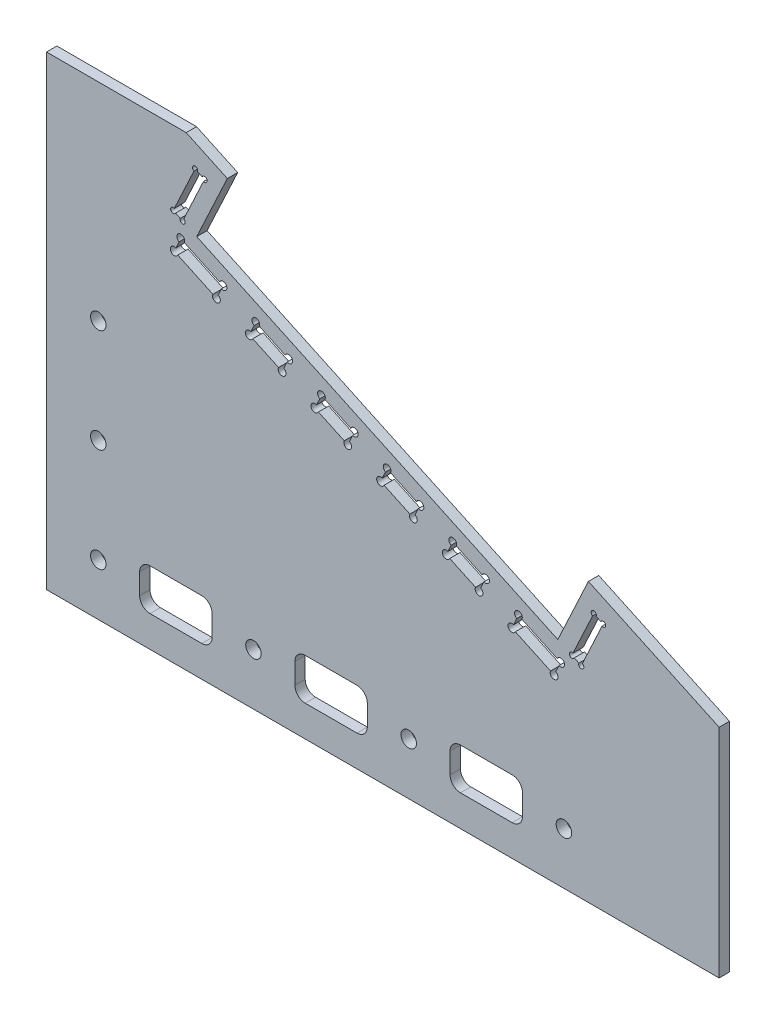
from build123d import *

# Parameters (mm, degrees)
SKETCH_1_W          = 130
SKETCH_1_H          = 90
SKETCH_1_R          = 1.5
EXTRUDE_1_DEPTH     = 2
CUT_EXTRUDE_1_DEPTH = 159.126531613
CUT_EXTRUDE_2_DEPTH = 159.126531613
CUT_EXTRUDE_3_DEPTH = 159.126531613
SKETCH_6_R          = 0.75
SKETCH_6_R_2        = 0.5
CUT_EXTRUDE_5_DEPTH = 10
CUT_EXTRUDE_7_DEPTH = 159.126531613


with BuildPart() as part:
    # 草图1 → 凸台-拉伸1 (new body)
    with BuildSketch(Plane.XY):
        with Locations((65, 45)):
            Rectangle(SKETCH_1_W, SKETCH_1_H)
        with Locations((10, 10)):
            Circle(SKETCH_1_R, mode=Mode.SUBTRACT)
        with Locations((10, 30)):
            Circle(SKETCH_1_R, mode=Mode.SUBTRACT)
        with Locations((10, 50)):
            Circle(SKETCH_1_R, mode=Mode.SUBTRACT)
        with Locations((40, 10)):
            Circle(SKETCH_1_R, mode=Mode.SUBTRACT)
        with Locations((70, 10)):
            Circle(SKETCH_1_R, mode=Mode.SUBTRACT)
        with Locations((100, 10)):
            Circle(SKETCH_1_R, mode=Mode.SUBTRACT)
    extrude(amount=EXTRUDE_1_DEPTH)

    # 草图2 → 切除-拉伸1 (cut, through all)
    with BuildSketch(Plane.XY.offset(2)):
        Polygon((27, 90), (130, 41.97031121), (130, 90), align=None)
    extrude(amount=-CUT_EXTRUDE_1_DEPTH, mode=Mode.SUBTRACT)

    # 草图3 → 切除-拉伸2 (cut, through all)
    with BuildSketch(Plane.XY.offset(2)):
        Polygon((34.948319292, 86.293637845), (104.734018894, 53.752031691), (98.81736323, 41.063722672), (29.031663628, 73.605328826), align=None)
    extrude(amount=-CUT_EXTRUDE_2_DEPTH, mode=Mode.SUBTRACT)

    # 草图4 → 切除-拉伸3 (cut, through all)
    with BuildSketch(Plane.XY.offset(2)):
        Polygon((30.538922884, 83.936261482), (26.312740267, 74.873183611), (24.491061615, 75.722646317), (28.717244232, 84.785724188), align=None)
        Polygon((105.762469208, 48.858945757), (101.536286591, 39.795867887), (103.348902165, 38.950631363), (107.575084782, 48.013709234), align=None)
        Polygon((25.951193269, 71.731641988), (34.107963352, 67.928077633), (32.840108567, 65.209154272), (24.683338483, 69.012718627), align=None)
        Polygon((40.452117861, 64.969749801), (46.79627237, 62.011421968), (45.528417585, 59.292498607), (39.184263076, 62.250826439), align=None)
        Polygon((78.517044917, 47.219782807), (84.861199426, 44.261454975), (83.593344641, 41.542531614), (77.249190132, 44.500859446), align=None)
        Polygon((91.205353935, 41.303127143), (99.362124019, 37.499562787), (98.094269233, 34.780639426), (89.93749915, 38.584203782), align=None)
        Polygon((53.14042688, 59.053094136), (59.484581389, 56.094766304), (58.216726604, 53.375842943), (51.872572095, 56.334170775), align=None)
        Polygon((65.828735898, 53.136438472), (72.172890408, 50.17811064), (70.905035622, 47.459187279), (64.560881113, 50.417515111), align=None)
    extrude(amount=-CUT_EXTRUDE_3_DEPTH, mode=Mode.SUBTRACT)

    # 草图6 → 切除-拉伸5 (cut)
    with BuildSketch(Plane.XY.offset(2)):
        with Locations((24.683338483, 69.012718627)):
            Circle(SKETCH_6_R)
        with Locations((25.951193269, 71.731641988)):
            Circle(SKETCH_6_R)
        with Locations((34.107963352, 67.928077633)):
            Circle(SKETCH_6_R)
        with Locations((32.840108567, 65.209154272)):
            Circle(SKETCH_6_R)
        with Locations((45.528417585, 59.292498607)):
            Circle(SKETCH_6_R)
        with Locations((39.184263076, 62.250826439)):
            Circle(SKETCH_6_R)
        with Locations((40.452117861, 64.969749801)):
            Circle(SKETCH_6_R)
        with Locations((46.79627237, 62.011421968)):
            Circle(SKETCH_6_R)
        with Locations((78.517044917, 47.219782807)):
            Circle(SKETCH_6_R)
        with Locations((77.249190132, 44.500859446)):
            Circle(SKETCH_6_R)
        with Locations((83.593344641, 41.542531614)):
            Circle(SKETCH_6_R)
        with Locations((84.861199426, 44.261454975)):
            Circle(SKETCH_6_R)
        with Locations((98.094269233, 34.780639426)):
            Circle(SKETCH_6_R)
        with Locations((99.362124019, 37.499562787)):
            Circle(SKETCH_6_R)
        with Locations((91.205353935, 41.303127143)):
            Circle(SKETCH_6_R)
        with Locations((89.93749915, 38.584203782)):
            Circle(SKETCH_6_R)
        with Locations((26.312740267, 74.873183611)):
            Circle(SKETCH_6_R_2)
        with Locations((24.491061615, 75.722646317)):
            Circle(SKETCH_6_R_2)
        with Locations((28.717244232, 84.785724188)):
            Circle(SKETCH_6_R_2)
        with Locations((30.538922884, 83.936261482)):
            Circle(SKETCH_6_R_2)
        with Locations((103.348902165, 38.950631363)):
            Circle(SKETCH_6_R_2)
        with Locations((101.536286591, 39.795867887)):
            Circle(SKETCH_6_R_2)
        with Locations((105.762469208, 48.858945757)):
            Circle(SKETCH_6_R_2)
        with Locations((107.575084782, 48.013709234)):
            Circle(SKETCH_6_R_2)
        with Locations((53.14042688, 59.053094136)):
            Circle(SKETCH_6_R)
        with Locations((59.484581389, 56.094766304)):
            Circle(SKETCH_6_R)
        with Locations((51.872572095, 56.334170775)):
            Circle(SKETCH_6_R)
        with Locations((58.216726604, 53.375842943)):
            Circle(SKETCH_6_R)
        with Locations((65.828735898, 53.136438472)):
            Circle(SKETCH_6_R)
        with Locations((72.172890408, 50.17811064)):
            Circle(SKETCH_6_R)
        with Locations((70.905035622, 47.459187279)):
            Circle(SKETCH_6_R)
        with Locations((64.560881113, 50.417515111)):
            Circle(SKETCH_6_R)
    extrude(amount=-CUT_EXTRUDE_5_DEPTH, mode=Mode.SUBTRACT)

    # 草图8 → 切除-拉伸7 (cut, through all)
    with BuildSketch(Plane(origin=(0, 0, 0), x_dir=(-1, 0, 0), z_dir=(0, 0, -1))):
        with BuildLine():
            Line((-90, 14), (-80, 14))
            ThreePointArc((-80, 14), (-78.585786438, 13.414213562), (-78, 12))
            Line((-78, 12), (-78, 8))
            ThreePointArc((-78, 8), (-78.585786438, 6.585786438), (-80, 6))
            Line((-80, 6), (-90, 6))
            ThreePointArc((-90, 6), (-91.414213562, 6.585786438), (-92, 8))
            Line((-92, 8), (-92, 12))
            ThreePointArc((-92, 12), (-91.414213562, 13.414213562), (-90, 14))
        make_face()
        with BuildLine():
            Line((-62, 8), (-62, 12))
            ThreePointArc((-62, 12), (-61.414213562, 13.414213562), (-60, 14))
            Line((-60, 14), (-50, 14))
            ThreePointArc((-50, 14), (-48.585786438, 13.414213562), (-48, 12))
            Line((-48, 12), (-48, 8))
            ThreePointArc((-48, 8), (-48.585786438, 6.585786438), (-50, 6))
            Line((-50, 6), (-60, 6))
            ThreePointArc((-60, 6), (-61.414213562, 6.585786438), (-62, 8))
        make_face()
        with BuildLine():
            Line((-30, 14), (-20, 14))
            ThreePointArc((-20, 14), (-18.585786438, 13.414213562), (-18, 12))
            Line((-18, 12), (-18, 8))
            ThreePointArc((-18, 8), (-18.585786438, 6.585786438), (-20, 6))
            Line((-20, 6), (-30, 6))
            ThreePointArc((-30, 6), (-31.414213562, 6.585786438), (-32, 8))
            Line((-32, 8), (-32, 12))
            ThreePointArc((-32, 12), (-31.414213562, 13.414213562), (-30, 14))
        make_face()
    extrude(amount=-CUT_EXTRUDE_7_DEPTH, mode=Mode.SUBTRACT)


solid = part.part
